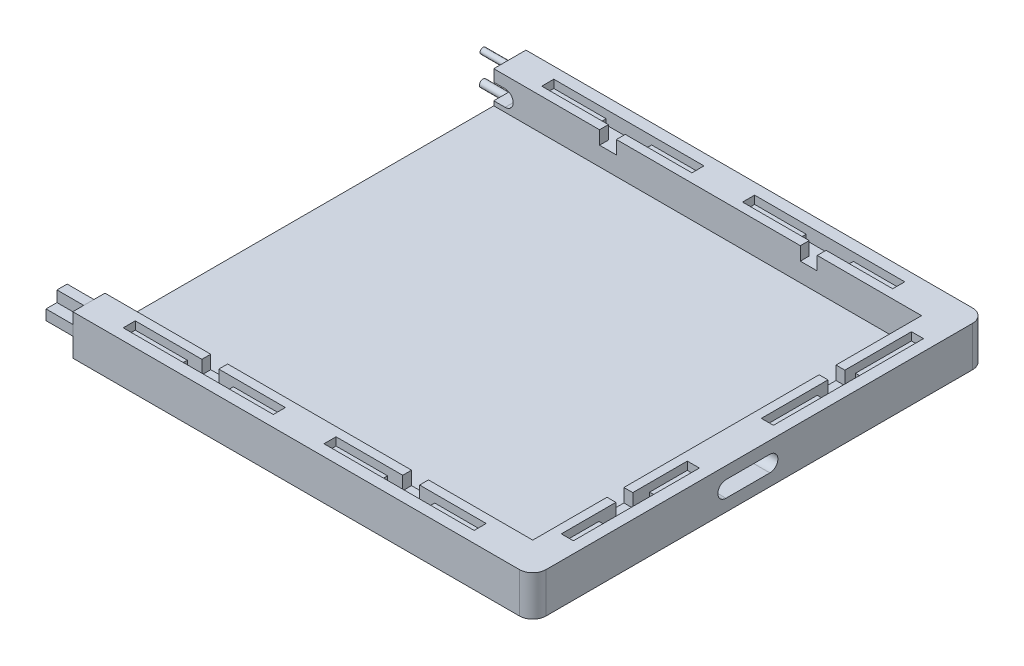
from build123d import *

# Parameters (mm, degrees)
SKETCH1_W           = 159.54
SKETCH1_H           = 145
BOSS_EXTRUDE1_DEPTH = 3
BOSS_EXTRUDE2_DEPTH = 15
CUT_EXTRUDE1_DEPTH  = 3
CUT_EXTRUDE2_DEPTH  = 2
CUT_EXTRUDE3_DEPTH  = 12
CUT_EXTRUDE4_DEPTH  = 12
SKETCH8_R           = 1.1
SKETCH8_R_2         = 1.35
BOSS_EXTRUDE3_DEPTH = 10
BOSS_EXTRUDE5_DEPTH = 10
FILLET3_R           = 5
FILLET4_R           = 5


with BuildPart() as part:
    # Sketch1 → Boss-Extrude1 (new body)
    with BuildSketch(Plane(origin=(0, 0, 0), x_dir=(1, 0, 0), z_dir=(0, 1, 0))):
        with Locations((79.77, 0)):
            Rectangle(SKETCH1_W, SKETCH1_H)
    extrude(amount=BOSS_EXTRUDE1_DEPTH)

    # Sketch3 → Boss-Extrude2 (add)
    with BuildSketch(Plane(origin=(0, 0, 0), x_dir=(1, 0, 0), z_dir=(0, 1, 0))):
        Polygon((0, 72.5), (0, 84.5), (171.54, 84.5), (171.54, -84.5), (0, -84.5), (0, -72.5), (159.54, -72.5), (159.54, 72.5), align=None)
    extrude(amount=BOSS_EXTRUDE2_DEPTH)

    # Sketch4 → Cut-Extrude1 (cut)
    with BuildSketch(Plane(origin=(0, 15, 0), x_dir=(1, 0, 0), z_dir=(0, 1, 0))):
        Polygon((45.75, 75.8), (45.75, 72.5), (39.45, 72.5), (39.45, 75.8), (14.6, 75.8), (14.6, 80.3), (70.6, 80.3), (70.6, 75.8), align=None)
        Polygon((120.64, 75.8), (120.64, 72.5), (114.34, 72.5), (114.34, 75.8), (89.49, 75.8), (89.49, 80.3), (145.49, 80.3), (145.49, 75.8), align=None)
        Polygon((145.49, -75.8), (120.64, -75.8), (120.64, -72.5), (114.34, -72.5), (114.34, -75.8), (89.49, -75.8), (89.49, -80.3), (145.49, -80.3), align=None)
        Polygon((70.6, -75.8), (45.75, -75.8), (45.75, -72.5), (39.45, -72.5), (39.45, -75.8), (14.6, -75.8), (14.6, -80.3), (70.6, -80.3), align=None)
        Polygon((159.54, -38.5), (162.84, -38.5), (162.84, -18.15), (167.34, -18.15), (167.34, -65.15), (162.84, -65.15), (162.84, -44.8), (159.54, -44.8), align=None)
        Polygon((159.54, 40.6), (162.84, 40.6), (162.84, 65.45), (167.34, 65.45), (167.34, 9.45), (162.84, 9.45), (162.84, 34.3), (159.54, 34.3), align=None)
    extrude(amount=-CUT_EXTRUDE1_DEPTH, mode=Mode.SUBTRACT)

    # Sketch5 → Cut-Extrude2 (cut)
    with BuildSketch(Plane(origin=(0, 12, 0), x_dir=(1, 0, 0), z_dir=(0, 1, 0))):
        Polygon((39.45, -72.5), (39.45, -75.8), (33.99806762, -75.8), (33.99806762, -80.3), (51.20193238, -80.3), (51.20193238, -75.8), (45.75, -75.8), (45.75, -72.5), align=None)
        Polygon((114.34, -75.8), (108.704865037, -75.8), (108.704865037, -80.3), (126.275134963, -80.3), (126.275134963, -75.8), (120.64, -75.8), (120.64, -72.5), (114.34, -72.5), align=None)
        Polygon((120.64, 72.5), (114.34, 72.5), (114.34, 75.8), (108.704865037, 75.8), (108.704865037, 80.3), (126.308635122, 80.3), (126.308635122, 75.8), (120.64, 75.8), align=None)
        Polygon((45.75, 72.5), (39.45, 72.5), (39.45, 75.8), (34.110302497, 75.8), (34.110302497, 80.3), (51.089697503, 80.3), (51.089697503, 75.8), (45.75, 75.8), align=None)
        Polygon((159.54, -44.8), (159.54, -38.5), (162.84, -38.5), (162.84, -32.205861204), (167.34, -32.205861204), (167.34, -51.094138796), (162.84, -51.094138796), (162.84, -44.8), align=None)
        Polygon((159.54, 40.6), (162.84, 40.6), (162.84, 44.579740263), (167.34, 44.579740263), (167.34, 30.320259737), (162.84, 30.320259737), (162.84, 34.3), (159.54, 34.3), align=None)
    extrude(amount=-CUT_EXTRUDE2_DEPTH, mode=Mode.SUBTRACT)

    # Sketch6 → Cut-Extrude3 (cut)
    with BuildSketch(Plane(origin=(171.54, 0, 0), x_dir=(0, 0, -1), z_dir=(1, 0, 0))):
        with BuildLine():
            Line((-12.45, 10.5), (3.93, 10.5))
            ThreePointArc((3.93, 10.5), (6.93, 7.5), (3.93, 4.5))
            Line((3.93, 4.5), (-12.45, 4.5))
            ThreePointArc((-12.45, 4.5), (-15.45, 7.5), (-12.45, 10.5))
        make_face()
    extrude(amount=-CUT_EXTRUDE3_DEPTH, mode=Mode.SUBTRACT)

    # Sketch7 → Cut-Extrude4 (cut)
    with BuildSketch(Plane(origin=(0, 0, -84.5), x_dir=(-1, 0, 0), z_dir=(0, 0, -1))):
        with BuildLine():
            Line((-4.24, 10.6343), (12.14, 10.6343))
            ThreePointArc((12.14, 10.6343), (15.14, 7.6343), (12.14, 4.6343))
            Line((12.14, 4.6343), (-4.24, 4.6343))
            ThreePointArc((-4.24, 4.6343), (-7.24, 7.6343), (-4.24, 10.6343))
        make_face()
    extrude(amount=-CUT_EXTRUDE4_DEPTH, mode=Mode.SUBTRACT)

    # Sketch8 → Boss-Extrude3 (add)
    with BuildSketch(Plane.ZY):
        with Locations((-78.5, 12.81715)):
            Circle(SKETCH8_R)
        with Locations((-78.5, 2.328843142)):
            Circle(SKETCH8_R_2)
    extrude(amount=BOSS_EXTRUDE3_DEPTH)

    # Sketch9 → Boss-Extrude5 (add)
    with BuildSketch(Plane.ZY):
        Polygon((76.6, 14.98895691), (80.4, 14.98895691), (80.4, 10.9), (84.489160504, 10.9), (84.489160504, 7.1), (80.4, 7.1), (80.4, 3.01104309), (76.6, 3.01104309), (76.6, 7.100000004), (72.511375857, 7.100000004), (72.511117499, 10.899999996), (76.6, 10.899999996), align=None)
    extrude(amount=BOSS_EXTRUDE5_DEPTH)

    # Fillet3
    fillet3_edges = [part.edges().sort_by_distance(p)[0] for p in [
        (171.54, 7.5, 84.5),
    ]]
    fillet(fillet3_edges, radius=FILLET3_R)

    # Fillet4
    fillet4_edges = [part.edges().sort_by_distance(p)[0] for p in [
        (171.54, 7.5, -84.5),
    ]]
    fillet(fillet4_edges, radius=FILLET4_R)


solid = part.part
